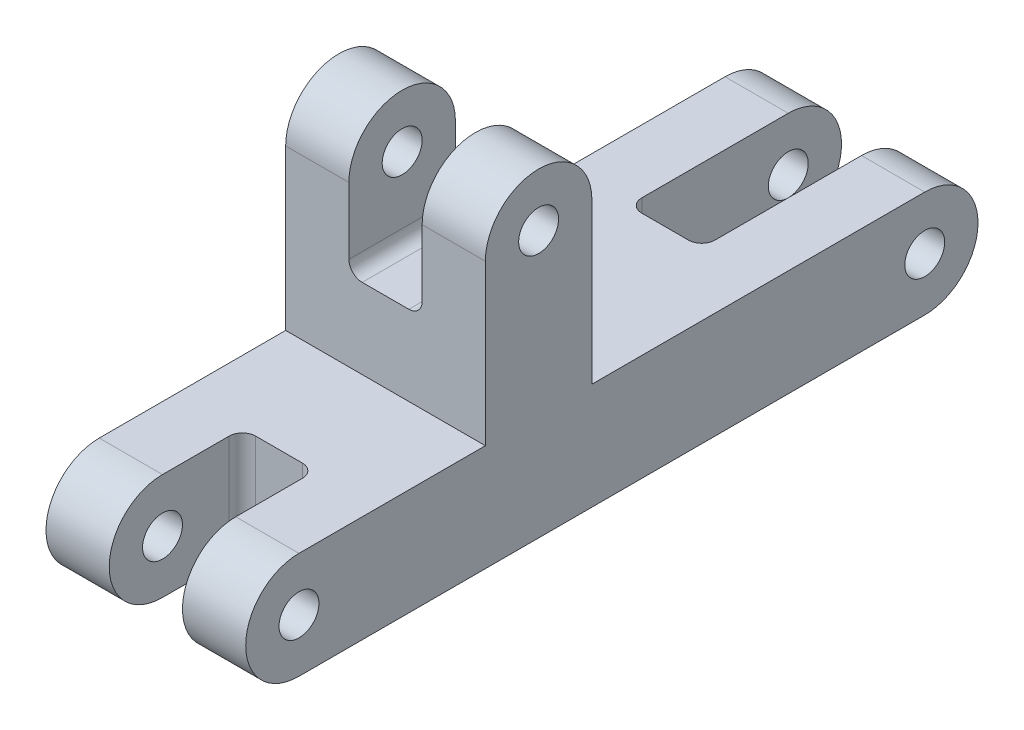
from build123d import *

# Parameters (mm, degrees)
CROQUIS1_R              = 1.5
SALIENTE_EXTRUIR1_DEPTH = 7.5
CROQUIS2_W              = 8
CROQUIS2_H              = 10
CROQUIS2_W_2            = 16
CROQUIS2_H_2            = 8
CROQUIS2_W_3            = 10
CORTAR_EXTRUIR1_DEPTH   = 2.75
REDONDEO1_R             = 1


with BuildPart() as part:
    # Croquis1 → Saliente-Extruir1 (new, symmetric)
    with BuildSketch(Plane(origin=(0, 0, 0), x_dir=(0, 0, -1), z_dir=(1, 0, 0))):
        with BuildLine():
            Line((-12.5, -4), (12.5, -4))
            ThreePointArc((12.5, -4), (16.5, 0), (12.5, 4))
            Line((12.5, 4), (-12.5, 4))
            Line((-12.5, 4), (-12.5, 16))
            ThreePointArc((-12.5, 16), (-16.5, 20), (-20.5, 16))
            Line((-20.5, 16), (-20.5, 4))
            Line((-20.5, 4), (-34.5, 4))
            ThreePointArc((-34.5, 4), (-38.5, 0), (-34.5, -4))
            Line((-34.5, -4), (-12.5, -4))
        make_face()
        with Locations((12.5, 0)):
            Circle(CROQUIS1_R, mode=Mode.SUBTRACT)
        with Locations((-16.5, 16)):
            Circle(CROQUIS1_R, mode=Mode.SUBTRACT)
        with Locations((-34.5, 0)):
            Circle(CROQUIS1_R, mode=Mode.SUBTRACT)
    extrude(amount=SALIENTE_EXTRUIR1_DEPTH, both=True)

    # Croquis2 → Cortar-Extruir1 (cut, symmetric)
    with BuildSketch(Plane(origin=(0, 0, 0), x_dir=(0, 0, -1), z_dir=(1, 0, 0))):
        with Locations((-16.5, 15)):
            Rectangle(CROQUIS2_W, CROQUIS2_H)
        with Locations((8.5, 0)):
            Rectangle(CROQUIS2_W_2, CROQUIS2_H_2)
        with Locations((-33.5, 0)):
            Rectangle(CROQUIS2_W_3, CROQUIS2_H_2)
    extrude(amount=CORTAR_EXTRUIR1_DEPTH, both=True, mode=Mode.SUBTRACT)

    # Redondeo1
    redondeo1_edges = [part.edges().sort_by_distance(p)[0] for p in [
        (2.75, 0, 28.5),
        (-2.75, 0, 28.5),
        (2.75, 0, -0.5),
        (-2.75, 0, -0.5),
        (2.75, 10, 16.5),
        (-2.75, 10, 16.5),
    ]]
    fillet(redondeo1_edges, radius=REDONDEO1_R)


solid = part.part
